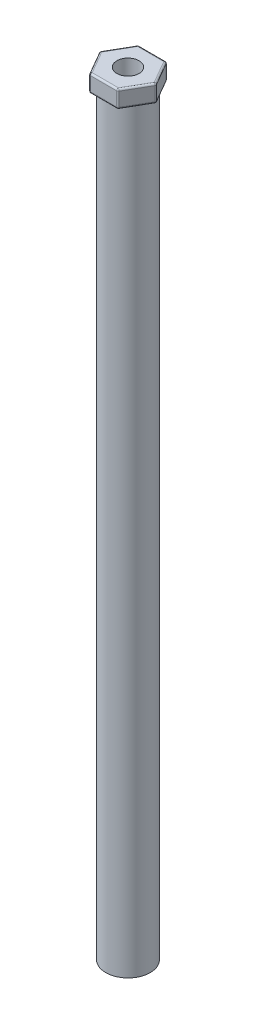
from build123d import *

# Parameters (mm, degrees)
SKETCH1_R           = 6.35
SKETCH1_R_2         = 3.175
BOSS_EXTRUDE1_DEPTH = 215.9
SKETCH2_R           = 3.175
BOSS_EXTRUDE2_DEPTH = 5
FILLET1_R           = 0.5


with BuildPart() as part:
    # Sketch1 → Boss-Extrude1 (new body)
    with BuildSketch(Plane(origin=(0, 0, 0), x_dir=(1, 0, 0), z_dir=(0, 1, 0))):
        Circle(SKETCH1_R)
        Circle(SKETCH1_R_2, mode=Mode.SUBTRACT)
    extrude(amount=BOSS_EXTRUDE1_DEPTH)

    # Sketch2 → Boss-Extrude2 (add)
    with BuildSketch(Plane(origin=(0, 215.9, 0), x_dir=(1, 0, 0), z_dir=(0, 1, 0))):
        Polygon((-8.065583261, 0), (-4.03279163, -6.985), (4.03279163, -6.985), (8.065583261, 0), (4.03279163, 6.985), (-4.03279163, 6.985), align=None)
        Circle(SKETCH2_R, mode=Mode.SUBTRACT)
    extrude(amount=BOSS_EXTRUDE2_DEPTH)

    # Fillet1
    fillet1_edges = [part.edges().sort_by_distance(p)[0] for p in [
        (6.049187445, 215.9, -3.4925),
        (4.03279163, 218.4, -6.985),
        (8.065583261, 218.4, 0),
        (-4.03279163, 218.4, -6.985),
        (-6.049187445, 215.9, -3.4925),
        (-8.065583261, 218.4, 0),
        (-6.049187445, 215.9, 3.4925),
        (-4.03279163, 218.4, 6.985),
        (0, 215.9, 6.985),
        (6.049187445, 215.9, 3.4925),
        (4.03279163, 218.4, 6.985),
        (6.049187445, 220.9, 3.4925),
        (6.049187445, 220.9, -3.4925),
        (0, 220.9, -6.985),
        (-6.049187445, 220.9, -3.4925),
        (-6.049187445, 220.9, 3.4925),
        (0, 220.9, 6.985),
        (0, 215.9, -6.985),
    ]]
    fillet(fillet1_edges, radius=FILLET1_R)


solid = part.part
